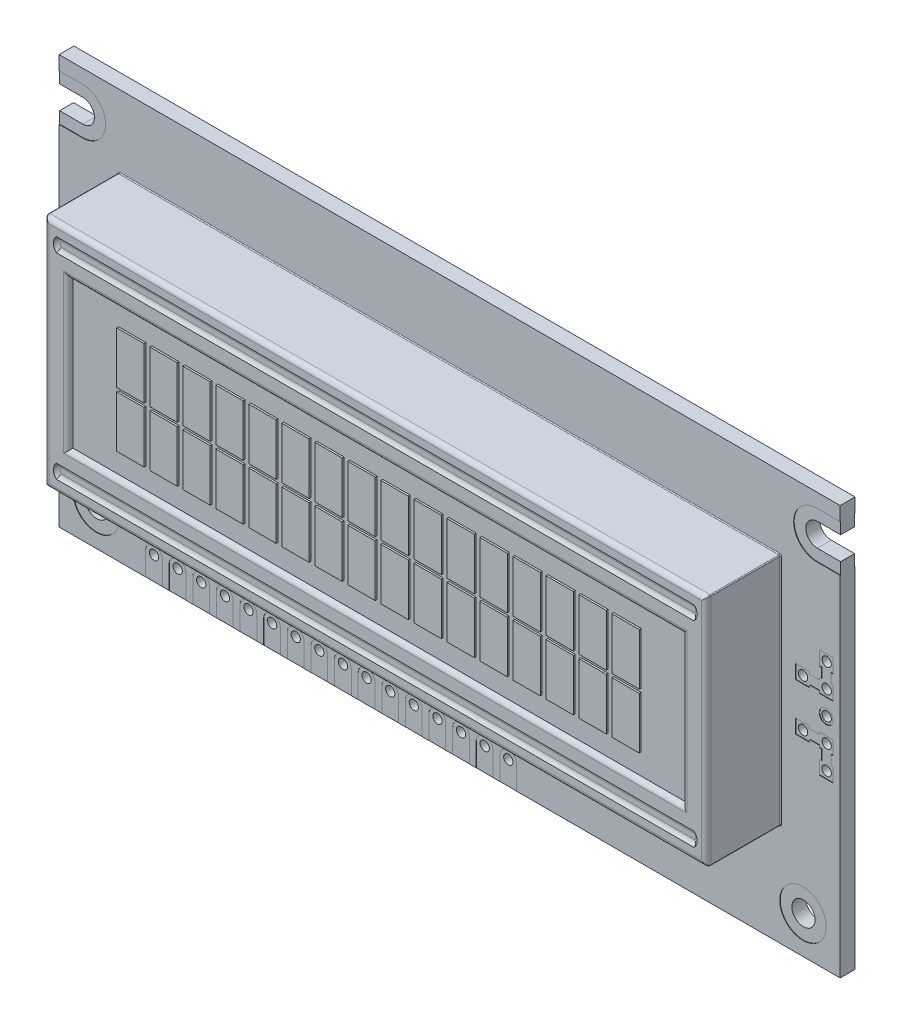
from build123d import *

# Parameters (mm, degrees)
IZIM1_W                     = 84
IZIM1_H                     = 44
Y_KSEKLIK_EKSTR_ZYON1_DEPTH = 1.6
KES_EKSTR_ZYON1_DEPTH       = 1.6
KES_EKSTR_ZYON2_DEPTH       = 1.6
IZIM4_R                     = 1.25
KES_EKSTR_ZYON3_DEPTH       = 1.6
IZIM5_R                     = 1.25
KES_EKSTR_ZYON4_DEPTH       = 1.6
IZIM6_R                     = 0.5
KES_EKSTR_ZYON5_DEPTH       = 1.6
L_O_ALTMA1_COUNT            = 16
L_O_ALTMA1_PITCH            = 2.54
KES_EKSTR_ZYON6_DEPTH       = 0.01
L_O_ALTMA2_COUNT            = 16
L_O_ALTMA2_PITCH            = 2.54
IZIM9_R                     = 2.5
KES_EKSTR_ZYON7_DEPTH       = 0.05
KES_EKSTR_ZYON8_DEPTH       = 0.05
KES_EKSTR_ZYON9_START       = -0.05
IZIM11_R                    = 2.5
KES_EKSTR_ZYON9_DEPTH       = 0.05
KES_EKSTR_ZYON10_START      = -0.05
KES_EKSTR_ZYON10_DEPTH      = 0.05
L_O_ALTMA3_COUNT            = 16
L_O_ALTMA3_PITCH            = 2.54
IZIM13_R                    = 0.5
KES_EKSTR_ZYON11_DEPTH      = 48.440067454
L_O_ALTMA4_COUNT            = 3
L_O_ALTMA4_PITCH            = 2.54
L_O_ALTMA4_COL_COUNT        = 3
L_O_ALTMA4_COL_PITCH        = 2.54
IZIM14_R                    = 0.5
KES_EKSTR_ZYON12_DEPTH      = 48.440067454
L_O_ALTMA5_COUNT            = 2
L_O_ALTMA5_PITCH            = 5.08
IZIM15_R                    = 0.75
KES_EKSTR_ZYON13_DEPTH      = 0.05
IZIM16_W                    = 71.2
IZIM16_H                    = 25.2
Y_KSEKLIK_EKSTR_ZYON3_DEPTH = 8
IZIM18_W                    = 66
IZIM18_H                    = 16
KES_EKSTR_ZYON15_DEPTH      = 0.5
IZIM19_W                    = 2.95
IZIM19_H                    = 5.55
Y_KSEKLIK_EKSTR_ZYON4_DEPTH = 0.2
L_O_ALTMA6_COUNT            = 16
L_O_ALTMA6_PITCH            = 3.55
RADYUS1_R                   = 0.5
RADYUS2_R                   = 0.1
KES_EKSTR_ZYON16_DEPTH      = 0.3
RADYUS3_START               = -34.610660272
RADYUS3_DEPTH               = 69.221320444
RADYUS3_2_ANGLE             = 90
RADYUS3_3_ANGLE             = 90
KES_EKSTR_ZYON17_DEPTH      = 0.3
RADYUS4_START               = -34.610660272
RADYUS4_DEPTH               = 69.221320444
RADYUS4_2_ANGLE             = 90
RADYUS4_3_ANGLE             = 90


with BuildPart() as part:
    # Çizim1 → Yükseklik-Ekstrüzyon1 (new body)
    with BuildSketch(Plane.XY):
        Rectangle(IZIM1_W, IZIM1_H)
    extrude(amount=Y_KSEKLIK_EKSTR_ZYON1_DEPTH)

    # Çizim2 → Kes-Ekstrüzyon1 (cut)
    with BuildSketch(Plane.XY.offset(1.6)):
        with BuildLine():
            Line((-42, 19.25), (-39.5, 19.25))
            ThreePointArc((-39.5, 19.25), (-38.25, 18), (-39.5, 16.75))
            Line((-39.5, 16.75), (-42, 16.75))
            Line((-42, 16.75), (-42, 19.25))
        make_face()
    extrude(amount=-KES_EKSTR_ZYON1_DEPTH, mode=Mode.SUBTRACT)

    # Çizim3 → Kes-Ekstrüzyon2 (cut)
    with BuildSketch(Plane.XY.offset(1.6)):
        with BuildLine():
            Line((42, 19.25), (39.5, 19.25))
            ThreePointArc((39.5, 19.25), (38.25, 18), (39.5, 16.75))
            Line((39.5, 16.75), (42, 16.75))
            Line((42, 16.75), (42, 19.25))
        make_face()
    extrude(amount=-KES_EKSTR_ZYON2_DEPTH, mode=Mode.SUBTRACT)

    # Çizim4 → Kes-Ekstrüzyon3 (cut)
    with BuildSketch(Plane.XY.offset(1.6)):
        with Locations((-38, -18)):
            Circle(IZIM4_R)
    extrude(amount=-KES_EKSTR_ZYON3_DEPTH, mode=Mode.SUBTRACT)

    # Çizim5 → Kes-Ekstrüzyon4 (cut)
    with BuildSketch(Plane.XY.offset(1.6)):
        with Locations((38, -18)):
            Circle(IZIM5_R)
    extrude(amount=-KES_EKSTR_ZYON4_DEPTH, mode=Mode.SUBTRACT)

    # Çizim6 → Kes-Ekstrüzyon5 (cut)
    with BuildSketch(Plane.XY.offset(1.6)):
        with Locations((-31.8, -19.5)):
            Circle(IZIM6_R)
    kes_ekstr_zyon5 = extrude(amount=-KES_EKSTR_ZYON5_DEPTH, mode=Mode.SUBTRACT)

    # LÇoğaltma1: Kes-Ekstrüzyon5 ×16
    with Locations(*[(i * L_O_ALTMA1_PITCH, 0, 0) for i in range(1, L_O_ALTMA1_COUNT)]):
        add(kes_ekstr_zyon5, mode=Mode.SUBTRACT)

    # Çizim8 → Kes-Ekstrüzyon6 (cut)
    with BuildSketch(Plane.XY.offset(1.6)):
        with BuildLine():
            Line((-30.9, -22), (-30.9, -19.5))
            ThreePointArc((-30.9, -19.5), (-31.8, -18.6), (-32.7, -19.5))
            Line((-32.7, -19.5), (-32.7, -22))
            Line((-32.7, -22), (-30.9, -22))
        make_face()
    kes_ekstr_zyon6 = extrude(amount=-KES_EKSTR_ZYON6_DEPTH, mode=Mode.SUBTRACT)

    # LÇoğaltma2: Kes-Ekstrüzyon6 ×16
    with Locations(*[(i * L_O_ALTMA2_PITCH, 0, 0) for i in range(1, L_O_ALTMA2_COUNT)]):
        add(kes_ekstr_zyon6, mode=Mode.SUBTRACT)

    # Çizim9 → Kes-Ekstrüzyon7 (cut)
    with BuildSketch(Plane.XY.offset(1.6)):
        with Locations((38, -18)):
            Circle(IZIM9_R)
        with Locations((-38, -18)):
            Circle(IZIM9_R)
    extrude(amount=-KES_EKSTR_ZYON7_DEPTH, mode=Mode.SUBTRACT)

    # Çizim10 → Kes-Ekstrüzyon8 (cut)
    with BuildSketch(Plane.XY.offset(1.6)):
        with BuildLine():
            Line((42, 15.5), (41.304278912, 15.5))
            Line((41.304278912, 15.5), (39.5, 15.5))
            ThreePointArc((39.5, 15.5), (37, 18), (39.5, 20.5))
            Line((39.5, 20.5), (42, 20.5))
            Line((42, 20.5), (42, 15.5))
        make_face()
        with BuildLine():
            Line((-42, 20.5), (-39.5, 20.5))
            ThreePointArc((-39.5, 20.5), (-37, 18), (-39.5, 15.5))
            Line((-39.5, 15.5), (-42, 15.5))
            Line((-42, 15.5), (-42, 20.5))
        make_face()
    extrude(amount=-KES_EKSTR_ZYON8_DEPTH, mode=Mode.SUBTRACT)

    # Çizim11 → Kes-Ekstrüzyon9 (cut)
    with BuildSketch(Plane(origin=(0, 0, 0), x_dir=(-1, 0, 0), z_dir=(0, 0, -1)).offset(KES_EKSTR_ZYON9_START)):
        with Locations(Location((38, -18, 0), (0, 0, 180))):
            Circle(IZIM11_R)
        with Locations(Location((-38, -18, 0), (0, 0, 180))):
            Circle(IZIM11_R)
        with BuildLine():
            Line((-42, 20.5), (-39.5, 20.5))
            ThreePointArc((-39.5, 20.5), (-37, 18), (-39.5, 15.5))
            Line((-39.5, 15.5), (-42, 15.5))
            Line((-42, 15.5), (-42, 20.5))
        make_face()
        with BuildLine():
            Line((42, 20.5), (39.5, 20.5))
            ThreePointArc((39.5, 20.5), (37, 18), (39.5, 15.5))
            Line((39.5, 15.5), (42, 15.5))
            Line((42, 15.5), (42, 20.5))
        make_face()
    extrude(amount=KES_EKSTR_ZYON9_DEPTH, mode=Mode.SUBTRACT)

    # Çizim12 → Kes-Ekstrüzyon10 (cut)
    with BuildSketch(Plane(origin=(0, 0, 0), x_dir=(-1, 0, 0), z_dir=(0, 0, -1)).offset(KES_EKSTR_ZYON10_START)):
        with BuildLine():
            Line((32.7, -19.5), (32.7, -22))
            Line((32.7, -22), (30.9, -22))
            Line((30.9, -22), (30.9, -19.5))
            ThreePointArc((30.9, -19.5), (31.8, -18.6), (32.7, -19.5))
        make_face()
    kes_ekstr_zyon10 = extrude(amount=KES_EKSTR_ZYON10_DEPTH, mode=Mode.SUBTRACT)

    # LÇoğaltma3: Kes-Ekstrüzyon10 ×16
    with Locations(*[(i * L_O_ALTMA3_PITCH, 0, 0) for i in range(1, L_O_ALTMA3_COUNT)]):
        add(kes_ekstr_zyon10, mode=Mode.SUBTRACT)

    # Çizim13 → Kes-Ekstrüzyon11 (cut, through all)
    with BuildSketch(Plane.XY.offset(1.6)):
        with Locations((40.5, 1.6)):
            Circle(IZIM13_R)
    kes_ekstr_zyon11 = extrude(amount=-KES_EKSTR_ZYON11_DEPTH, mode=Mode.SUBTRACT)

    # LÇoğaltma4: Kes-Ekstrüzyon11 ×3
    with Locations(*[(0, -i * L_O_ALTMA4_PITCH, 0) for i in range(1, L_O_ALTMA4_COUNT)]):
        add(kes_ekstr_zyon11, mode=Mode.SUBTRACT)

    # LÇoğaltma4 col: Kes-Ekstrüzyon11 ×3
    with Locations(*[(0, i * L_O_ALTMA4_COL_PITCH, 0) for i in range(1, L_O_ALTMA4_COL_COUNT)]):
        add(kes_ekstr_zyon11, mode=Mode.SUBTRACT)

    # Çizim14 → Kes-Ekstrüzyon12 (cut, through all)
    with BuildSketch(Plane.XY.offset(1.6)):
        with Locations((37.96, 4.14)):
            Circle(IZIM14_R)
    kes_ekstr_zyon12 = extrude(amount=-KES_EKSTR_ZYON12_DEPTH, mode=Mode.SUBTRACT)

    # LÇoğaltma5: Kes-Ekstrüzyon12 ×2
    with Locations(*[(0, -i * L_O_ALTMA5_PITCH, 0) for i in range(1, L_O_ALTMA5_COUNT)]):
        add(kes_ekstr_zyon12, mode=Mode.SUBTRACT)

    # Çizim15 → Kes-Ekstrüzyon13 (cut)
    with BuildSketch(Plane.XY.offset(1.6)):
        with Locations((40.5, 1.6)):
            Circle(IZIM15_R)
        Polygon((41, 5.93), (41.25, 5.93), (41.25, 7.43), (39.75, 7.43), (39.75, 5.93), (40, 5.93), (40, 4.89), (39.75, 4.89), (39.75, 4.64), (38.71, 4.64), (38.71, 4.89), (37.21, 4.89), (37.21, 3.39), (38.71, 3.39), (38.71, 3.64), (39.75, 3.64), (39.75, 3.39), (41.25, 3.39), (41.25, 4.89), (41, 4.89), align=None)
        Polygon((39.75, -0.19), (41.25, -0.19), (41.25, -1.69), (41, -1.69), (41, -2.73), (41.25, -2.73), (41.25, -4.23), (39.75, -4.23), (39.75, -2.73), (40, -2.73), (40, -1.69), (39.75, -1.69), (39.75, -1.44), (38.71, -1.44), (38.71, -1.69), (37.21, -1.69), (37.21, -0.19), (38.71, -0.19), (38.71, -0.44), (39.75, -0.44), align=None)
    extrude(amount=-KES_EKSTR_ZYON13_DEPTH, mode=Mode.SUBTRACT)

    # Çizim16 → Yükseklik-Ekstrüzyon3 (add)
    with BuildSketch(Plane.XY.offset(1.6)):
        with Locations((0, 1.6)):
            Rectangle(IZIM16_W, IZIM16_H)
    extrude(amount=Y_KSEKLIK_EKSTR_ZYON3_DEPTH)

    # Çizim18 → Kes-Ekstrüzyon15 (cut)
    with BuildSketch(Plane.XY.offset(9.6)):
        with Locations((0, 1.6)):
            Rectangle(IZIM18_W, IZIM18_H)
    extrude(amount=-KES_EKSTR_ZYON15_DEPTH, mode=Mode.SUBTRACT)

    # Çizim19 → Yükseklik-Ekstrüzyon4 (add)
    with BuildSketch(Plane.XY.offset(9.1)):
        with Locations((-26.625, 4.575)):
            Rectangle(IZIM19_W, IZIM19_H)
        with Locations((-26.625, -1.375)):
            Rectangle(IZIM19_W, IZIM19_H)
    y_kseklik_ekstr_zyon4 = extrude(amount=Y_KSEKLIK_EKSTR_ZYON4_DEPTH)

    # LÇoğaltma6: Yükseklik-Ekstrüzyon4 ×16
    with Locations(*[(i * L_O_ALTMA6_PITCH, 0, 0) for i in range(1, L_O_ALTMA6_COUNT)]):
        add(y_kseklik_ekstr_zyon4)

    # Radyus1
    radyus1_edges = [part.edges().sort_by_distance(p)[0] for p in [
        (0, 14.2, 9.6),
        (35.6, 1.6, 9.6),
        (0, -11, 9.6),
        (-35.6, 1.6, 9.6),
        (0, -6.4, 9.6),
        (33, 1.6, 9.6),
        (0, 9.6, 9.6),
        (-33, 1.6, 9.6),
    ]]
    fillet(radyus1_edges, radius=RADYUS1_R - 0.0001)  # a hair under: the kernel refuses the full size

    # Radyus2
    radyus2_edges = [part.edges().sort_by_distance(p)[0] for p in [
        (-35.6, 14.2, 5.35005),
        (35.6, 14.2, 5.35005),
        (35.6, -11, 5.35005),
        (-35.6, -11, 5.35005),
        (35.423059849, -10.823059849, 9.481671679),
        (-35.423059849, -10.823059849, 9.481671679),
        (35.423059849, 14.023059849, 9.481671679),
        (-35.423059849, 14.023059849, 9.481671679),
        (-35.6, 1.6, 1.6),
        (0, -11, 1.6),
        (35.6, 1.6, 1.6),
        (0, 14.2, 1.6),
    ]]
    fillet(radyus2_edges, radius=RADYUS2_R)

    # Çizim21 → Kes-Ekstrüzyon16 (cut)
    with BuildSketch(Plane.XY.offset(9.6)):
        with BuildLine():
            Line((-34.3, 12.9), (34.3, 12.9))
            ThreePointArc((34.3, 12.9), (34.610660172, 12.15), (34.3, 11.4))
            Line((34.3, 11.4), (-34.3, 11.4))
            ThreePointArc((-34.3, 11.4), (-34.610660172, 12.15), (-34.3, 12.9))
        make_face()
    extrude(amount=-KES_EKSTR_ZYON16_DEPTH, mode=Mode.SUBTRACT)

    # Radyus3: read off the stored shape, not the designer's step
    # Radyus3 outline → Radyus3 (add)
    with BuildSketch(Plane.YZ.offset(RADYUS3_START)):
        with BuildLine():
            Line((11.4, 9.3), (11.858257569, 9.3))
            ThreePointArc((11.858257569, 9.3), (11.584396291, 9.381669987), (11.4, 9.6))
            Line((11.4, 9.6), (11.4, 9.3))
        make_face()
        with BuildLine():
            ThreePointArc((12.9, 9.6), (12.715603709, 9.381669987), (12.441742431, 9.3))
            Line((12.441742431, 9.3), (12.9, 9.3))
            Line((12.9, 9.3), (12.9, 9.6))
        make_face()
    extrude(amount=RADYUS3_DEPTH)

    # Radyus3 2 outline → Radyus3 2 (revolve)
    with BuildSketch(Plane(origin=(33.55, 12.15, 0), x_dir=(0.7071067811865192, -0.7071067811865759, 0), z_dir=(-0.7071067811865759, -0.7071067811865192, 0))):
        with BuildLine():
            Line((1.060660172, 9.3), (1.060660172, 9.6))
            ThreePointArc((1.060660172, 9.6), (0.876263881, 9.381669987), (0.602402602, 9.3))
            Line((0.602402602, 9.3), (1.060660172, 9.3))
        make_face()
    revolve(axis=Axis((33.55, 12.15, 0), (0, 0, 1)), revolution_arc=RADYUS3_2_ANGLE)

    # Radyus3 3 outline → Radyus3 3 (revolve)
    with BuildSketch(Plane(origin=(-33.55, 12.15, 0), x_dir=(-0.7071067811865477, 0.7071067811865475, 0), z_dir=(0.7071067811865475, 0.7071067811865477, 0))):
        with BuildLine():
            Line((1.060660172, 9.3), (1.060660172, 9.6))
            ThreePointArc((1.060660172, 9.6), (0.876263881, 9.381669987), (0.602402602, 9.3))
            Line((0.602402602, 9.3), (1.060660172, 9.3))
        make_face()
    revolve(axis=Axis((-33.55, 12.15, 0), (0, 0, 1)), revolution_arc=RADYUS3_3_ANGLE)

    # Çizim22 → Kes-Ekstrüzyon17 (cut)
    with BuildSketch(Plane.XY.offset(9.6)):
        with BuildLine():
            Line((-34.3, -8.2), (34.3, -8.2))
            ThreePointArc((34.3, -8.2), (34.610660172, -8.95), (34.3, -9.7))
            Line((34.3, -9.7), (-34.3, -9.7))
            ThreePointArc((-34.3, -9.7), (-34.610660172, -8.95), (-34.3, -8.2))
        make_face()
    extrude(amount=-KES_EKSTR_ZYON17_DEPTH, mode=Mode.SUBTRACT)

    # Radyus4: read off the stored shape, not the designer's step
    # Radyus4 outline → Radyus4 (add)
    with BuildSketch(Plane.YZ.offset(RADYUS4_START)):
        with BuildLine():
            Line((-9.7, 9.3), (-9.241742431, 9.3))
            ThreePointArc((-9.241742431, 9.3), (-9.515603709, 9.381669987), (-9.7, 9.6))
            Line((-9.7, 9.6), (-9.7, 9.3))
        make_face()
        with BuildLine():
            ThreePointArc((-8.2, 9.6), (-8.384396291, 9.381669987), (-8.658257569, 9.3))
            Line((-8.658257569, 9.3), (-8.2, 9.3))
            Line((-8.2, 9.3), (-8.2, 9.6))
        make_face()
    extrude(amount=RADYUS4_DEPTH)

    # Radyus4 2 outline → Radyus4 2 (revolve)
    with BuildSketch(Plane(origin=(33.55, -8.95, 0), x_dir=(0.7071067811865476, -0.7071067811865475, 0), z_dir=(-0.7071067811865475, -0.7071067811865476, 0))):
        with BuildLine():
            Line((1.060660172, 9.3), (1.060660172, 9.6))
            ThreePointArc((1.060660172, 9.6), (0.876263881, 9.381669987), (0.602402602, 9.3))
            Line((0.602402602, 9.3), (1.060660172, 9.3))
        make_face()
    revolve(axis=Axis((33.55, -8.95, 0), (0, 0, 1)), revolution_arc=RADYUS4_2_ANGLE)

    # Radyus4 3 outline → Radyus4 3 (revolve)
    with BuildSketch(Plane(origin=(-33.55, -8.95, 0), x_dir=(-0.7071067811865474, 0.7071067811865477, 0), z_dir=(0.7071067811865477, 0.7071067811865474, 0))):
        with BuildLine():
            Line((1.060660172, 9.3), (1.060660172, 9.6))
            ThreePointArc((1.060660172, 9.6), (0.876263881, 9.381669987), (0.602402602, 9.3))
            Line((0.602402602, 9.3), (1.060660172, 9.3))
        make_face()
    revolve(axis=Axis((-33.55, -8.95, 0), (0, 0, 1)), revolution_arc=RADYUS4_3_ANGLE)


solid = part.part
